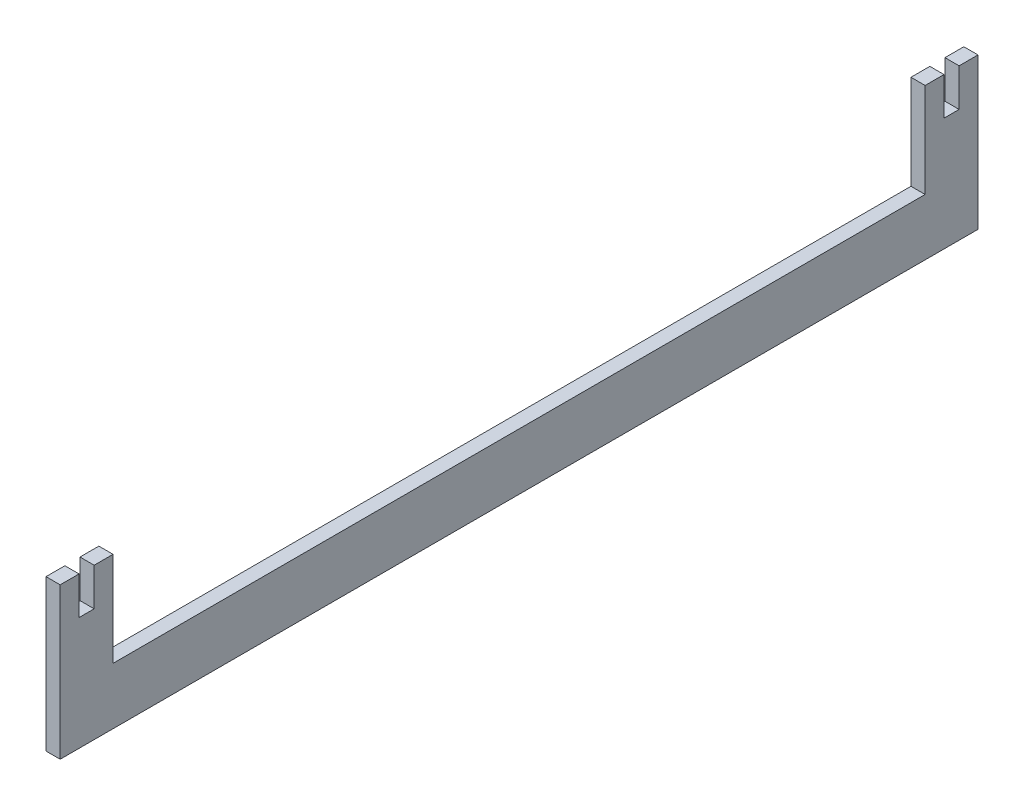
from build123d import *

# Parameters (mm, degrees)
BOSS_EXTRUDE1_DEPTH = 3


with BuildPart() as part:
    # Sketch1 → Boss-Extrude1 (new body)
    with BuildSketch(Plane(origin=(0, 0, 0), x_dir=(0, 0, -1), z_dir=(1, 0, 0))):
        Polygon((-97.2, 32), (-97.2, 0), (97.2, 0), (97.2, 32), (93.2, 32), (93.2, 24), (90, 24), (90, 32), (86, 32), (86, 12), (-86, 12), (-86, 32), (-90, 32), (-90, 24), (-93.2, 24), (-93.2, 32), align=None)
    extrude(amount=BOSS_EXTRUDE1_DEPTH)


solid = part.part
